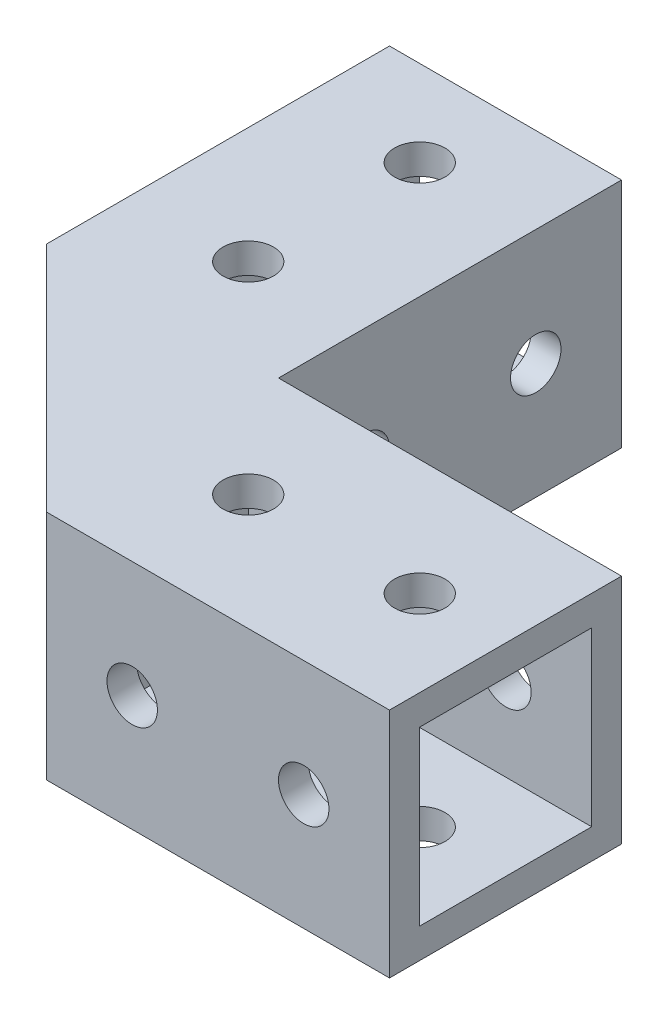
from build123d import *

# Parameters (mm, degrees)
SKETCH1_W           = 34
SKETCH1_H           = 23
SKETCH1_R           = 2.5
BOSS_EXTRUDE1_DEPTH = 23
SKETCH6_OUTSIDE_W   = 45.41
SKETCH6_OUTSIDE_H   = 34.41
SKETCH6_OUTSIDE_W_2 = 34
SKETCH6_OUTSIDE_H_2 = 23
SKETCH6_OUTSIDE_R   = 2.5
CUT_EXTRUDE10_DEPTH = 48.053161424
SKETCH7_OUTSIDE_W   = 34.41
SKETCH7_OUTSIDE_H   = 34.41
SKETCH7_OUTSIDE_W_2 = 23
SKETCH7_OUTSIDE_H_2 = 23
SKETCH7_OUTSIDE_W_3 = 17.08
SKETCH7_OUTSIDE_H_3 = 17.08
CUT_EXTRUDE11_DEPTH = 34
BOSS_EXTRUDE2_DEPTH = 23
SKETCH13_R          = 2.5
BOSS_EXTRUDE3_DEPTH = 4


with BuildPart() as part:
    # sketch1 → Boss-Extrude1 (new body)
    with BuildSketch(Plane(origin=(0, 0, 0), x_dir=(1, 0, 0), z_dir=(0, 1, 0))):
        with Locations((17, -11.5)):
            Rectangle(SKETCH1_W, SKETCH1_H)
        with Locations((8.5, -11.5)):
            Circle(SKETCH1_R, mode=Mode.SUBTRACT)
        with Locations((25.5, -11.5)):
            Circle(SKETCH1_R, mode=Mode.SUBTRACT)
    extrude(amount=BOSS_EXTRUDE1_DEPTH)

    # Sketch6 outside → Cut-Extrude10 (cut, through all)
    # profile 1 of 3: a face of its own
    with BuildSketch(Plane(origin=(0, 0, 0), x_dir=(-1, 0, 0), z_dir=(0, 0, -1))):
        with Locations((-17, 11.5)):
            Rectangle(SKETCH6_OUTSIDE_W, SKETCH6_OUTSIDE_H)
        with Locations((-17, 11.5)):
            Rectangle(SKETCH6_OUTSIDE_W_2, SKETCH6_OUTSIDE_H_2, mode=Mode.SUBTRACT)
    # profile 2 of 3: a face of its own
    with BuildSketch(Plane(origin=(0, 0, 0), x_dir=(-1, 0, 0), z_dir=(0, 0, -1))):
        with Locations((-25.5, 11.5)):
            Circle(SKETCH6_OUTSIDE_R)
    # profile 3 of 3: a face of its own
    with BuildSketch(Plane(origin=(0, 0, 0), x_dir=(-1, 0, 0), z_dir=(0, 0, -1))):
        with Locations((-8.5, 11.5)):
            Circle(SKETCH6_OUTSIDE_R)
    extrude(amount=-CUT_EXTRUDE10_DEPTH, mode=Mode.SUBTRACT)

    # Sketch7 outside → Cut-Extrude11 (cut)
    # profile 1 of 2: a face of its own
    with BuildSketch(Plane(origin=(34, 0, 0), x_dir=(0, 0, -1), z_dir=(1, 0, 0))):
        with Locations((-11.5, 11.5)):
            Rectangle(SKETCH7_OUTSIDE_W, SKETCH7_OUTSIDE_H)
        with Locations((-11.5, 11.5)):
            Rectangle(SKETCH7_OUTSIDE_W_2, SKETCH7_OUTSIDE_H_2, mode=Mode.SUBTRACT)
    # profile 2 of 2: a face of its own
    with BuildSketch(Plane(origin=(34, 0, 0), x_dir=(0, 0, -1), z_dir=(1, 0, 0))):
        with Locations((-11.5, 11.5)):
            Rectangle(SKETCH7_OUTSIDE_W_3, SKETCH7_OUTSIDE_H_3)
    extrude(amount=-CUT_EXTRUDE11_DEPTH, mode=Mode.SUBTRACT)


with BuildPart() as body_2:
    # Mirror6: mirrored copy
    add(part.part.mirror(Plane(origin=(0, 0, 0), x_dir=(-0.7071067811865462, 0, 0.7071067811865489), z_dir=(-0.707106781186549, 0, -0.7071067811865461))))


with BuildPart() as part_1:
    add(part.part)

    add(body_2.part)  # Boss-Extrude2 merges body 2
    # Sketch11 → Boss-Extrude2 (add)
    with BuildSketch(Plane(origin=(0, 0, 0), x_dir=(1, 0, 0), z_dir=(0, 1, 0))):
        Polygon((-23, 0), (0, -23), (0, 0), align=None)
    extrude(amount=BOSS_EXTRUDE2_DEPTH)

    # Sketch13 → Boss-Extrude3 (add)
    with BuildSketch(Plane(origin=(0, 0, 0), x_dir=(1, 0, 0), z_dir=(0, 1, 0))):
        Polygon((8.706365938, 8.706365938), (0, 17), (0, 0), (17, 0), align=None)
        with Locations((5.170832032, 5.170832032)):
            Circle(SKETCH13_R, mode=Mode.SUBTRACT)
    extrude(amount=BOSS_EXTRUDE3_DEPTH)


solid = part_1.part
